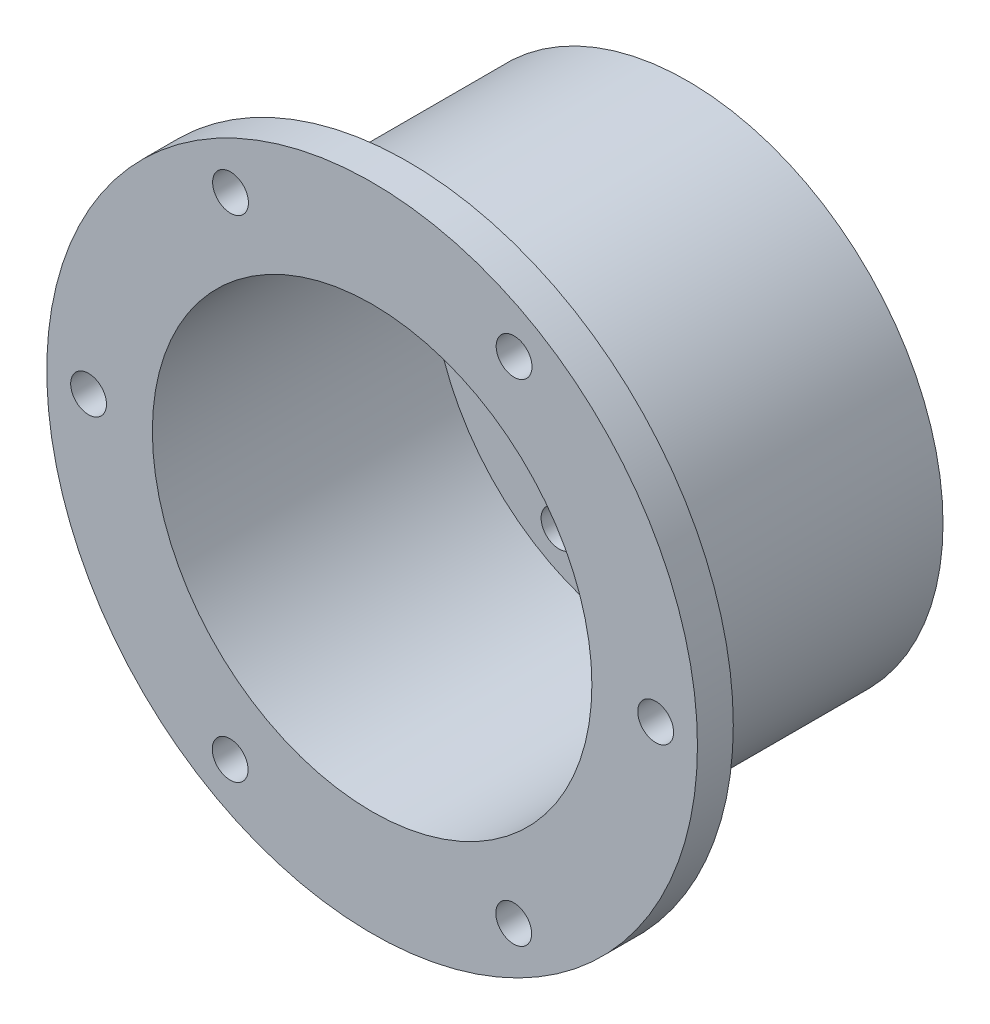
from build123d import *

# Parameters (mm, degrees)
CROQUIS1_R              = 21.4
CROQUIS1_R_2            = 18.4
SALIENTE_EXTRUIR1_DEPTH = 26.4
CROQUIS2_R              = 18.4
SALIENTE_EXTRUIR2_DEPTH = 3
SALIENTE_EXTRUIR3_START = -3
CROQUIS3_R              = 27.24
CROQUIS3_R_2            = 21.4
SALIENTE_EXTRUIR3_DEPTH = 3
CROQUIS4_R              = 6
CROQUIS4_R_2            = 1.5
CORTAR_EXTRUIR1_DEPTH   = 3
CROQUIS6_R              = 1.5
CORTAR_EXTRUIR2_DEPTH   = 3


with BuildPart() as part:
    # Croquis1 → Saliente-Extruir1 (new body)
    with BuildSketch(Plane.XY):
        Circle(CROQUIS1_R)
        Circle(CROQUIS1_R_2, mode=Mode.SUBTRACT)
    extrude(amount=SALIENTE_EXTRUIR1_DEPTH)

    # Croquis2 → Saliente-Extruir2 (add)
    with BuildSketch(Plane(origin=(0, 0, 0), x_dir=(-1, 0, 0), z_dir=(0, 0, -1))):
        Circle(CROQUIS2_R)
    extrude(amount=-SALIENTE_EXTRUIR2_DEPTH)

    # Croquis3 → Saliente-Extruir3 (add)
    with BuildSketch(Plane.XY.offset(26.4).offset(SALIENTE_EXTRUIR3_START)):
        Circle(CROQUIS3_R)
        Circle(CROQUIS3_R_2, mode=Mode.SUBTRACT)
    extrude(amount=SALIENTE_EXTRUIR3_DEPTH)

    # Croquis4 → Cortar-Extruir1 (cut)
    with BuildSketch(Plane(origin=(0, 0, 0), x_dir=(-1, 0, 0), z_dir=(0, 0, -1))):
        with Locations((0, -7)):
            Circle(CROQUIS4_R)
        with Locations((-15.5, 0)):
            Circle(CROQUIS4_R_2)
        with Locations((-7.75, 13.423393759)):
            Circle(CROQUIS4_R_2)
        with Locations((7.75, 13.423393759)):
            Circle(CROQUIS4_R_2)
        with Locations((15.5, 0)):
            Circle(CROQUIS4_R_2)
        with Locations((7.75, -13.423393759)):
            Circle(CROQUIS4_R_2)
        with Locations((-7.75, -13.423393759)):
            Circle(CROQUIS4_R_2)
    extrude(amount=-CORTAR_EXTRUIR1_DEPTH, mode=Mode.SUBTRACT)

    # Croquis6 → Cortar-Extruir2 (cut)
    with BuildSketch(Plane.XY.offset(26.4)):
        with Locations((-11.854123509, 20.568601212)):
            Circle(CROQUIS6_R)
        with Locations((11.885869416, 20.550272705)):
            Circle(CROQUIS6_R)
        with Locations((23.739992925, -0.018328508)):
            Circle(CROQUIS6_R)
        with Locations((11.854123509, -20.568601212)):
            Circle(CROQUIS6_R)
        with Locations((-11.885869416, -20.550272705)):
            Circle(CROQUIS6_R)
        with Locations((-23.739992925, 0.018328508)):
            Circle(CROQUIS6_R)
    extrude(amount=-CORTAR_EXTRUIR2_DEPTH, mode=Mode.SUBTRACT)


solid = part.part
